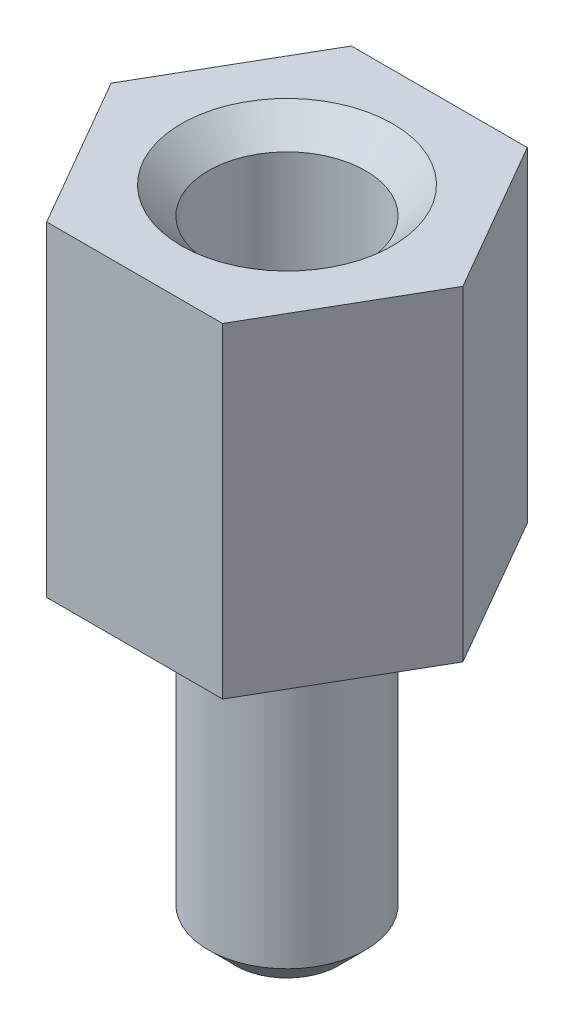
from build123d import *

# Parameters (mm, degrees)
BOSS_EXTRUDE1_DEPTH = 6
SKETCH2_R           = 1.45
BOSS_EXTRUDE2_DEPTH = 6
SKETCH3_R           = 1.45
CUT_EXTRUDE1_DEPTH  = 5
CHAMFER1_SIZE       = 0.5


with BuildPart() as part:
    # Sketch1 → Boss-Extrude1 (new body)
    with BuildSketch(Plane(origin=(0, 0, 0), x_dir=(1, 0, 0), z_dir=(0, 1, 0))):
        Polygon((3.244708513, 0), (1.622354256, 2.81), (-1.622354256, 2.81), (-3.244708513, 0), (-1.622354256, -2.81), (1.622354256, -2.81), align=None)
    extrude(amount=BOSS_EXTRUDE1_DEPTH)

    # Sketch2 → Boss-Extrude2 (add)
    with BuildSketch(Plane.XZ):
        Circle(SKETCH2_R)
    extrude(amount=BOSS_EXTRUDE2_DEPTH)

    # Sketch3 → Cut-Extrude1 (cut)
    with BuildSketch(Plane(origin=(0, 6, 0), x_dir=(1, 0, 0), z_dir=(0, 1, 0))):
        Circle(SKETCH3_R)
    extrude(amount=-CUT_EXTRUDE1_DEPTH, mode=Mode.SUBTRACT)

    # Chamfer1
    chamfer1_edges = [part.edges().sort_by_distance(p)[0] for p in [
        (-1.45, -6, 0),
        (-1.45, 6, 0),
    ]]
    chamfer(chamfer1_edges, length=CHAMFER1_SIZE)


solid = part.part
